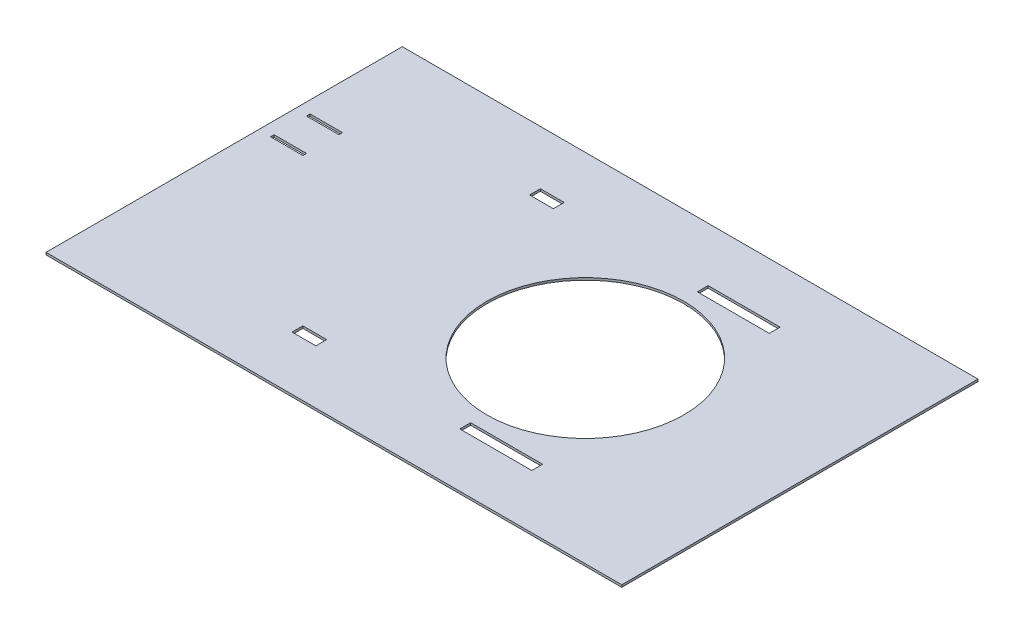
from build123d import *

# Parameters (mm, degrees)
SKETCH1_W           = 774.399048194
SKETCH1_H           = 479.155972021
SKETCH1_R           = 132.5
SKETCH1_W_2         = 96.798630461
SKETCH1_H_2         = 14.521545359
SKETCH1_W_3         = 43.564636075
SKETCH1_H_3         = 4.843849956
SKETCH1_H_4         = 4.840515119
SKETCH1_W_4         = 32.042776111
SKETCH1_H_5         = 14.521545358
SKETCH1_W_5         = 96.800297879
BOSS_EXTRUDE1_DEPTH = 3


with BuildPart() as part:
    # Sketch1 → Boss-Extrude1 (new body)
    with BuildSketch(Plane(origin=(0, 0, 0), x_dir=(1, 0, 0), z_dir=(0, 1, 0))):
        with Locations((18.492501871, 8.703923156)):
            Rectangle(SKETCH1_W, SKETCH1_H)
        with Locations((117.131797495, 8.694974108)):
            Circle(SKETCH1_R, mode=Mode.SUBTRACT)
        with Locations((163.687112726, 168.409746788)):
            Rectangle(SKETCH1_W_2, SKETCH1_H_2, mode=Mode.SUBTRACT)
        with Locations((-330.567331361, 57.104905805)):
            Rectangle(SKETCH1_W_3, SKETCH1_H_3, mode=Mode.SUBTRACT)
        with Locations((-330.567331361, 105.511724418)):
            Rectangle(SKETCH1_W_3, SKETCH1_H_4, mode=Mode.SUBTRACT)
        with Locations((-94.3325189, -151.010565638)):
            Rectangle(SKETCH1_W_4, SKETCH1_H_5, mode=Mode.SUBTRACT)
        with Locations((-94.3325189, 168.421746788)):
            Rectangle(SKETCH1_W_4, SKETCH1_H_2, mode=Mode.SUBTRACT)
        with Locations((163.69294869, -151.010565638)):
            Rectangle(SKETCH1_W_5, SKETCH1_H_5, mode=Mode.SUBTRACT)
    extrude(amount=BOSS_EXTRUDE1_DEPTH)


solid = part.part
